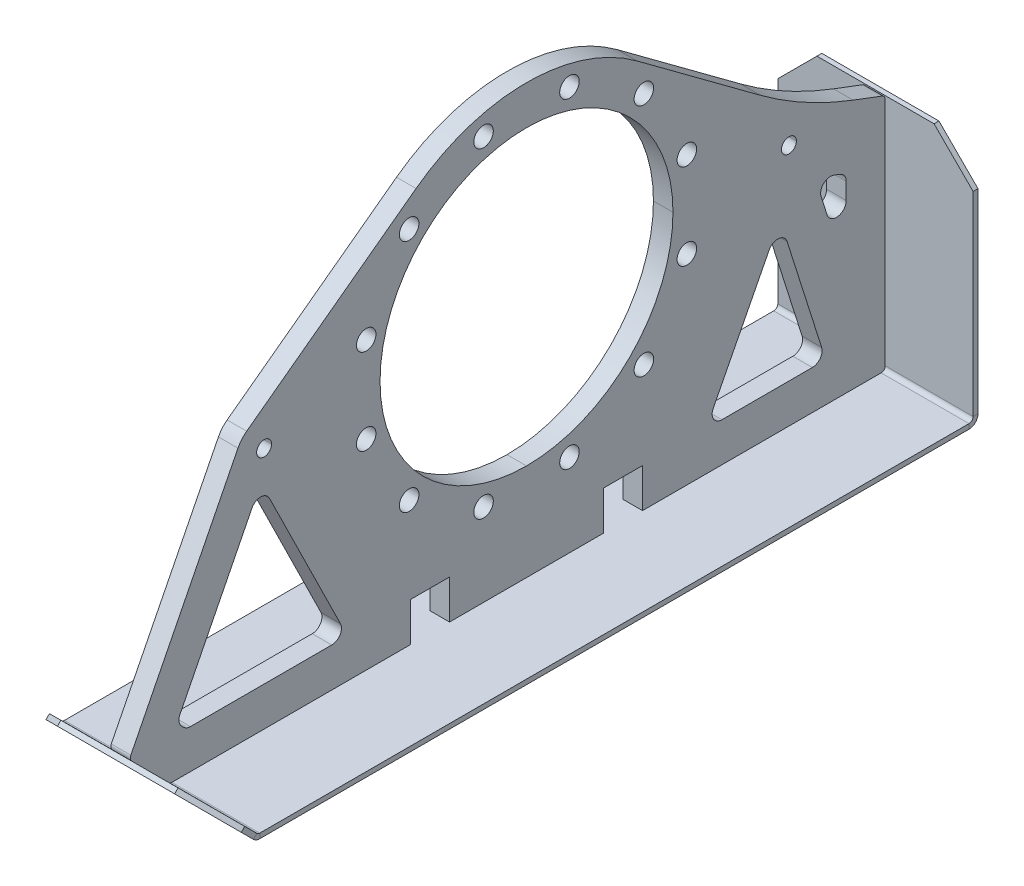
from build123d import *

# Parameters (mm, degrees)
SKETCH5_W                            = 254
SKETCH5_H                            = 1317.865260112
BASE_SKID_DEPTH                      = 6.35
BEND_START                           = -127
BEND_HEEL_DEPTH                      = 254
BEND_HEEL_2_DEPTH                    = 254
BEND_TOE_DEPTH                       = 254
BEND_TOE_2_DEPTH                     = 254
SILHOUETTE_DEPTH                     = 12.7
MANIFOLD_BORE_DEPTH                  = 774.747599071
MANIFOLD_BORE_DEPTH_BACK             = 774.747599071
FLANGE_PATTERN_R                     = 190.5
SKETCH3_W                            = 12.7
SKETCH3_H                            = 139.7
BOLT_PATTERN_COUNT                   = 12
SKETCH21_W                           = 9.72312
SKETCH21_H                           = 139.7
BEAM_START                           = -12.7
CROSSBRACE_W                         = 50.8
CROSSBRACE_H                         = 50.8
BEAM_CHANNELS_DEPTH                  = 25.4
WEBS_DEPTH                           = 774.747599071
WEBS_DEPTH_BACK                      = 774.747599071
WEBS_FILLET_R                        = 12.7
EDGE_FILLET_R                        = 6.35
SPINE_FILLET_R                       = 500
SKID_START                           = -374.774748962
SKID_EDGES_OUTLINE_W                 = 201
SKID_EDGES_OUTLINE_H                 = 6.35
SKID_EDGES_DEPTH                     = 35.921024484
SKID_START_2                         = 338.853724478
SKID_EDGES_2_OUTLINE_W               = 200
SKID_EDGES_2_OUTLINE_H               = 6.35
SKID_EDGES_2_DEPTH                   = 35.921024484
SKID_START_3                         = -308.768451674
SKID_EDGES_3_OUTLINE_W               = 200
SKID_EDGES_3_OUTLINE_H               = 9
SKID_EDGES_3_DEPTH                   = 35.921024485
SKID_START_4                         = 272.847427189
SKID_EDGES_4_OUTLINE_W               = 201
SKID_EDGES_4_OUTLINE_H               = 9
SKID_EDGES_4_DEPTH                   = 35.921024485
CONVERT_START                        = -12.7
CONVERT_PROFILE_TO_SHEET_OUTLINE_R   = 12.7
CONVERT_PROFILE_TO_SHEET_OUTLINE_R_2 = 9.72312
CONVERT_PROFILE_TO_SHEET_OUTLINE_R_3 = 190.5
CONVERT_PROFILE_TO_SHEET_DEPTH       = 25.4


# Read off the part's stored shape, not the designer's step: Bend Heel, Bend Toe, Skid Edges, Convert Profile to Sheet
# Sheet-metal steps are written as plain solids
with BuildPart() as part:
    # Sketch5 → Base Skid (new body)
    with BuildSketch(Plane(origin=(0, 0, 0), x_dir=(1, 0, 0), z_dir=(0, 1, 0))):
        with Locations((0, 118.6125)):
            Rectangle(SKETCH5_W, SKETCH5_H)
    extrude(amount=-BASE_SKID_DEPTH)

    # Bend Heel outline → Bend Heel (cut)
    with BuildSketch(Plane.YZ.offset(BEND_START)):
        with BuildLine():
            Line((0, -777.545130056), (0, -471.640528076))
            ThreePointArc((0, -471.640528076), (-4.636915504, -467.33583609), (-6.35, -461.245130056))
            Line((-6.35, -461.245130056), (-6.35, -777.545130056))
            Line((-6.35, -777.545130056), (0, -777.545130056))
        make_face()
    extrude(amount=BEND_HEEL_DEPTH, mode=Mode.SUBTRACT)

    # Bend Heel 2 outline → Bend Heel 2 (add)
    with BuildSketch(Plane.YZ.offset(BEND_START)):
        with BuildLine():
            Line((5.334, -472.929130056), (309.66453199, -472.929130056))
            Line((309.66453199, -472.929130056), (309.66453199, -466.579130056))
            Line((309.66453199, -466.579130056), (5.334, -466.579130056))
            ThreePointArc((5.334, -466.579130056), (1.56229243, -465.016837626), (0, -461.245130056))
            Line((0, -461.245130056), (0, -471.640528076))
            ThreePointArc((0, -471.640528076), (2.590277571, -472.602411563), (5.334, -472.929130056))
        make_face()
    extrude(amount=BEND_HEEL_2_DEPTH)

    # Bend Toe outline → Bend Toe (cut)
    with BuildSketch(Plane.YZ.offset(BEND_START)):
        with BuildLine():
            Line((-6.35, 540.320130056), (-6.35, 461.245130056))
            ThreePointArc((-6.35, 461.245130056), (-5.460608458, 465.71640328), (-2.927835631, 469.506965687))
            Line((-2.927835631, 469.506965687), (0, 472.434801318))
            Line((0, 472.434801318), (0, 540.320130056))
            Line((0, 540.320130056), (-6.35, 540.320130056))
        make_face()
    extrude(amount=BEND_TOE_DEPTH, mode=Mode.SUBTRACT)

    # Bend Toe 2 outline → Bend Toe 2 (add)
    with BuildSketch(Plane.YZ.offset(BEND_START)):
        with BuildLine():
            Line((48.754787092, 521.189588411), (0, 472.434801318))
            Line((0, 472.434801318), (0, 461.245130056))
            ThreePointArc((0, 461.245130056), (0.406026574, 463.286363484), (1.562292429, 465.016837626))
            Line((1.562292429, 465.016837626), (53.244915153, 516.69946035))
            Line((53.244915153, 516.69946035), (48.754787092, 521.189588411))
        make_face()
    extrude(amount=BEND_TOE_2_DEPTH)

    # Skid Edges outline → Skid Edges (cut)
    with BuildSketch(Plane(origin=(0, 0, 0), x_dir=(0.7071067811865501, 0.4999999999999991, 0.499999999999997), z_dir=(0.7071067811865449, -0.5000000000000029, -0.5000000000000008)).offset(SKID_START)):
        with Locations((258.5, 330.886851681)):
            Rectangle(SKID_EDGES_OUTLINE_W, SKID_EDGES_OUTLINE_H)
    extrude(amount=SKID_EDGES_DEPTH, mode=Mode.SUBTRACT)

    # Skid Edges 2 outline → Skid Edges 2 (cut)
    with BuildSketch(Plane(origin=(0, 0, 0), x_dir=(0.7071067811865501, -0.4999999999999991, -0.499999999999997), z_dir=(0.7071067811865449, 0.5000000000000029, 0.5000000000000008)).offset(SKID_START_2)):
        with Locations((-258, -330.886851681)):
            Rectangle(SKID_EDGES_2_OUTLINE_W, SKID_EDGES_2_OUTLINE_H)
    extrude(amount=SKID_EDGES_2_DEPTH, mode=Mode.SUBTRACT)

    # Skid Edges 3 outline → Skid Edges 3 (cut)
    with BuildSketch(Plane(origin=(0, 0, 0), x_dir=(0.7071067811865474, 0.7071067811865477, 0), z_dir=(0.7071067811865476, -0.7071067811865476, 0)).offset(SKID_START_3)):
        with Locations((192, -469.5)):
            Rectangle(SKID_EDGES_3_OUTLINE_W, SKID_EDGES_3_OUTLINE_H)
    extrude(amount=SKID_EDGES_3_DEPTH, mode=Mode.SUBTRACT)

    # Skid Edges 4 outline → Skid Edges 4 (cut)
    with BuildSketch(Plane(origin=(0, 0, 0), x_dir=(0.707106781186548, -0.707106781186547, 0), z_dir=(0.707106781186547, 0.707106781186548, 0)).offset(SKID_START_4)):
        with Locations((-192.5, 469.5)):
            Rectangle(SKID_EDGES_4_OUTLINE_W, SKID_EDGES_4_OUTLINE_H)
    extrude(amount=SKID_EDGES_4_DEPTH, mode=Mode.SUBTRACT)


with BuildPart() as body_2:
    # profile → Silhouette (new, symmetric)
    with BuildSketch(Plane(origin=(0, 0, 0), x_dir=(0, 0, -1), z_dir=(1, 0, 0))):
        with BuildLine():
            Line((-516.69946035, 53.244915153), (-375.315537192, 333.462553119))
            ThreePointArc((-375.315537192, 333.462553119), (-370.436182371, 340.849804008), (-363.983621447, 346.911489968))
            Line((-363.983621447, 346.911489968), (-143.662935834, 510.172769794))
            ThreePointArc((-143.662935834, 510.172769794), (0, 557.6), (143.662935834, 510.172769794))
            Line((143.662935834, 510.172769794), (359.728434803, 350.0646538))
            Line((359.728434803, 350.0646538), (466.579130056, 309.66453199))
            Line((466.579130056, 309.66453199), (466.579130056, 5.334))
            ThreePointArc((466.579130056, 5.334), (465.016837626, 1.562292429), (461.245130056, 0))
            Line((461.245130056, 0), (-461.245130056, 0))
            ThreePointArc((-461.245130056, 0), (-463.286363484, 0.406026574), (-465.016837626, 1.562292429))
            Line((-465.016837626, 1.562292429), (-516.69946035, 53.244915153))
        make_face()
    extrude(amount=SILHOUETTE_DEPTH, both=True)

    # Flange Pattern → Manifold Bore (cut, two sides: drawn at the far end of the back side and taken through both)
    with BuildSketch(Plane(origin=(0, 0, 0), x_dir=(0, 0, -1), z_dir=(1, 0, 0)).offset(-MANIFOLD_BORE_DEPTH_BACK)):
        with Locations((0, 316.3)):
            Circle(FLANGE_PATTERN_R)
    extrude(amount=MANIFOLD_BORE_DEPTH + MANIFOLD_BORE_DEPTH_BACK, mode=Mode.SUBTRACT)

    # Sketch3 → 7/8 (1) Diameter Hole1 (revolve, cut)
    with BuildSketch(Plane(origin=(12.7, 260.420968162, -208.543385896), x_dir=(0, 0, -1), z_dir=(0, 1, 0))):
        with Locations((6.35, 69.85)):
            Rectangle(SKETCH3_W, SKETCH3_H)
    f_7_8_1_diameter_hole1 = revolve(axis=Axis((19.05, 260.420968162, -208.543385896), (-1, 0, 0)), mode=Mode.SUBTRACT)

    # Bolt Pattern: 7/8 (1) Diameter Hole1 ×12 about axis
    bolt_pattern_axis = Axis((0, 316.3, 0), (1, 0, 0))
    for i in range(1, BOLT_PATTERN_COUNT):
        add(f_7_8_1_diameter_hole1.rotate(bolt_pattern_axis, i * 360 / BOLT_PATTERN_COUNT), mode=Mode.SUBTRACT)

    # Sketch21 → 3/4 (0.7656) Diameter Hole1 (revolve, cut)
    with BuildSketch(Plane(origin=(12.7, 316.3, -341.3), x_dir=(0, 0, -1), z_dir=(0, 1, 0))):
        with Locations((4.86156, 69.85)):
            Rectangle(SKETCH21_W, SKETCH21_H)
    f_3_4_0_7656_diameter_hole1 = revolve(axis=Axis((19.05, 316.3, -341.3), (-1, 0, 0)), mode=Mode.SUBTRACT)

    # Hoist Mirror: 3/4 (0.7656) Diameter Hole1 across plane
    add(f_3_4_0_7656_diameter_hole1.mirror(Plane.XY), mode=Mode.SUBTRACT)

    # Crossbrace → Beam Channels (cut)
    with BuildSketch(Plane(origin=(0, 0, 0), x_dir=(0, 0, -1), z_dir=(1, 0, 0)).offset(BEAM_START)):
        with Locations((125.5, 25.4)):
            Rectangle(CROSSBRACE_W, CROSSBRACE_H)
        with Locations((-125.5, 25.4)):
            Rectangle(CROSSBRACE_W, CROSSBRACE_H)
    extrude(amount=BEAM_CHANNELS_DEPTH, mode=Mode.SUBTRACT)

    # lightening holes → Webs (cut, two sides: drawn at the far end of the back side and taken through both)
    with BuildSketch(Plane(origin=(0, 0, 0), x_dir=(0, 0, -1), z_dir=(1, 0, 0)).offset(-WEBS_DEPTH_BACK)):
        Polygon((329.604282546, 238.525599733), (233.384249051, 50.8), (389.132672405, 50.8), align=None)
        Polygon((-442.412496229, 50.8), (-232.934161694, 50.8), (-345.643389962, 279.498206095), (-454.788729364, 63.176233135), align=None)
        Polygon((415.779130056, 134.830867543), (375.217673302, 262.743344484), (415.779130056, 247.407105541), align=None)
    extrude(amount=WEBS_DEPTH + WEBS_DEPTH_BACK, mode=Mode.SUBTRACT)

    # Webs Fillet
    webs_fillet_edges = [body_2.edges().sort_by_distance(p)[0] for p in [
        (0, 247.407105541, -415.779130056),
        (0, 134.830867543, -415.779130056),
        (0, 262.743344484, -375.217673302),
        (0, 63.176233135, 454.788729364),
        (0, 279.498206095, 345.643389962),
        (0, 50.8, 232.934161694),
        (0, 50.8, 442.412496229),
        (0, 50.8, -233.384249051),
        (0, 238.525599733, -329.604282546),
        (0, 50.8, -389.132672405),
    ]]
    fillet(webs_fillet_edges, radius=WEBS_FILLET_R)

    # Edge fillet
    edge_fillet_edges = [body_2.edges().sort_by_distance(p)[0] for p in [
        (0, 53.244915153, 516.69946035),
        (0, 309.66453199, -466.579130056),
    ]]
    fillet(edge_fillet_edges, radius=EDGE_FILLET_R)

    # Spine fillet
    spine_fillet_edges = [body_2.edges().sort_by_distance(p)[0] for p in [
        (0, 350.0646538, -359.728434803),
    ]]
    fillet(spine_fillet_edges, radius=SPINE_FILLET_R)


with BuildPart() as body_3:
    # Convert Profile to Sheet outline → Convert Profile to Sheet (new body)
    with BuildSketch(Plane.YZ.offset(CONVERT_START)):
        with BuildLine():
            Line((0, 100.1), (0, -100.1))
            Line((0, -100.1), (50.8, -100.1))
            Line((50.8, -100.1), (50.8, -150.9))
            Line((50.8, -150.9), (0, -150.9))
            Line((0, -150.9), (0, -461.245130056))
            ThreePointArc((0, -461.245130056), (1.56229243, -465.016837626), (5.334, -466.579130056))
            Line((5.334, -466.579130056), (305.276722288, -466.579130056))
            ThreePointArc((305.276722288, -466.579130056), (308.886563682, -465.453261094), (311.216339445, -462.474892295))
            Line((311.216339445, -462.474892295), (325.483956442, -424.739738848))
            ThreePointArc((325.483956442, -424.739738848), (354.284599622, -362.031642084), (391.444756589, -303.886090391))
            Line((391.444756589, -303.886090391), (510.172769794, -143.662935834))
            ThreePointArc((510.172769794, -143.662935834), (557.6, 0), (510.172769794, 143.662935834))
            Line((510.172769794, 143.662935834), (346.911489968, 363.983621447))
            ThreePointArc((346.911489968, 363.983621447), (340.849804008, 370.436182371), (333.462553119, 375.315537192))
            Line((333.462553119, 375.315537192), (57.346755421, 514.629875176))
            ThreePointArc((57.346755421, 514.629875176), (53.480562341, 515.230462007), (49.99620184, 513.450747037))
            Line((49.99620184, 513.450747037), (1.562292429, 465.016837626))
            ThreePointArc((1.562292429, 465.016837626), (0.406026574, 463.286363484), (0, 461.245130056))
            Line((0, 461.245130056), (0, 150.9))
            Line((0, 150.9), (50.8, 150.9))
            Line((50.8, 150.9), (50.8, 100.1))
            Line((50.8, 100.1), (0, 100.1))
        make_face()
        with BuildLine():
            ThreePointArc((50.8, -254.164782729), (56.877286844, -243.328285581), (69.292861488, -242.862891039))
            Line((69.292861488, -242.862891039), (211.058703387, -315.52593793))
            ThreePointArc((211.058703387, -315.52593793), (217.921821537, -327.884323534), (209.104669337, -338.933753951))
            Line((209.104669337, -338.933753951), (67.338827438, -383.888157171))
            ThreePointArc((67.338827438, -383.888157171), (55.998770383, -382.030235291), (50.8, -371.78223284))
            Line((50.8, -371.78223284), (50.8, -254.164782729))
        make_face(mode=Mode.SUBTRACT)
        with BuildLine():
            ThreePointArc((250.510720451, -407.570654534), (245.851168927, -413.527392133), (238.631486139, -415.779130056))
            Line((238.631486139, -415.779130056), (216.896353438, -415.779130056))
            ThreePointArc((216.896353438, -415.779130056), (204.345751082, -405.021391753), (213.057525999, -390.973205725))
            Line((213.057525999, -390.973205725), (237.753631588, -383.141991423))
            ThreePointArc((237.753631588, -383.141991423), (250.813677082, -386.515267955), (253.47169334, -399.739440232))
            Line((253.47169334, -399.739440232), (250.510720451, -407.570654534))
        make_face(mode=Mode.SUBTRACT)
        with Locations((107.756614104, -55.879031838)):
            Circle(CONVERT_PROFILE_TO_SHEET_OUTLINE_R, mode=Mode.SUBTRACT)
        with Locations((163.635645942, -152.664354058)):
            Circle(CONVERT_PROFILE_TO_SHEET_OUTLINE_R, mode=Mode.SUBTRACT)
        with Locations((260.420968162, -208.543385896)):
            Circle(CONVERT_PROFILE_TO_SHEET_OUTLINE_R, mode=Mode.SUBTRACT)
        with Locations((316.3, -341.3)):
            Circle(CONVERT_PROFILE_TO_SHEET_OUTLINE_R_2, mode=Mode.SUBTRACT)
        with Locations((372.179031838, -208.543385896)):
            Circle(CONVERT_PROFILE_TO_SHEET_OUTLINE_R, mode=Mode.SUBTRACT)
        with Locations((316.3, 0)):
            Circle(CONVERT_PROFILE_TO_SHEET_OUTLINE_R_3, mode=Mode.SUBTRACT)
        with Locations((468.964354058, -152.664354058)):
            Circle(CONVERT_PROFILE_TO_SHEET_OUTLINE_R, mode=Mode.SUBTRACT)
        with Locations((524.843385896, -55.879031838)):
            Circle(CONVERT_PROFILE_TO_SHEET_OUTLINE_R, mode=Mode.SUBTRACT)
        with Locations((107.756614104, 55.879031838)):
            Circle(CONVERT_PROFILE_TO_SHEET_OUTLINE_R, mode=Mode.SUBTRACT)
        with Locations((163.635645942, 152.664354058)):
            Circle(CONVERT_PROFILE_TO_SHEET_OUTLINE_R, mode=Mode.SUBTRACT)
        with Locations((260.420968162, 208.543385896)):
            Circle(CONVERT_PROFILE_TO_SHEET_OUTLINE_R, mode=Mode.SUBTRACT)
        with BuildLine():
            Line((71.379913671, 450.649559015), (256.760984496, 357.115464363))
            ThreePointArc((256.760984496, 357.115464363), (263.739993588, 345.717347832), (256.654304954, 334.385241014))
            Line((256.654304954, 334.385241014), (69.114171497, 241.959926132))
            ThreePointArc((69.114171497, 241.959926132), (56.792167936, 242.567621644), (50.8, 253.351637084))
            Line((50.8, 253.351637084), (50.8, 437.151983987))
            ThreePointArc((50.8, 437.151983987), (51.766729937, 442.012063578), (54.519743879, 446.132240108))
            Line((54.519743879, 446.132240108), (56.67880651, 448.291302739))
            ThreePointArc((56.67880651, 448.291302739), (63.647527512, 451.850732677), (71.379913671, 450.649559015))
        make_face(mode=Mode.SUBTRACT)
        with Locations((372.179031838, 208.543385896)):
            Circle(CONVERT_PROFILE_TO_SHEET_OUTLINE_R, mode=Mode.SUBTRACT)
        with Locations((524.843385896, 55.879031838)):
            Circle(CONVERT_PROFILE_TO_SHEET_OUTLINE_R, mode=Mode.SUBTRACT)
        with Locations((468.964354058, 152.664354058)):
            Circle(CONVERT_PROFILE_TO_SHEET_OUTLINE_R, mode=Mode.SUBTRACT)
        with Locations((316.3, 341.3)):
            Circle(CONVERT_PROFILE_TO_SHEET_OUTLINE_R_2, mode=Mode.SUBTRACT)
    extrude(amount=CONVERT_PROFILE_TO_SHEET_DEPTH)


solid = Compound([part.part, body_3.part])
